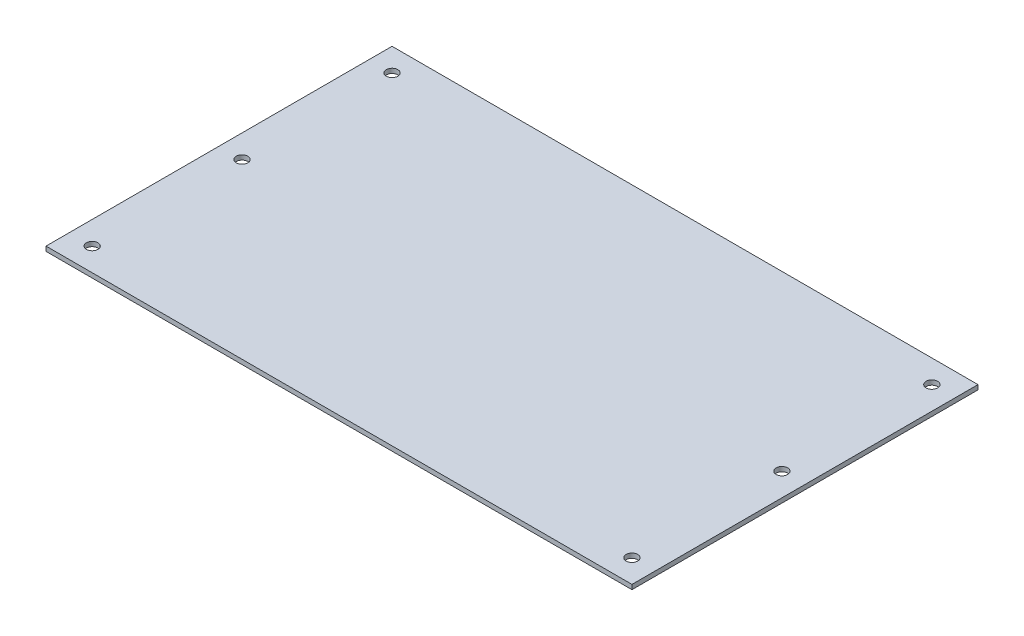
from build123d import *

# Parameters (mm, degrees)
SZKIC1_W                    = 254
SZKIC1_H                    = 150
SZKIC1_R                    = 2.5
DODANIE_WYCI_GNI_CIE1_DEPTH = 2


with BuildPart() as part:
    # Szkic1 → Dodanie-wyciągnięcie1 (new body)
    with BuildSketch(Plane(origin=(0, 0, 0), x_dir=(1, 0, 0), z_dir=(0, 1, 0))):
        Rectangle(SZKIC1_W, SZKIC1_H)
        with Locations((-117, -65)):
            Circle(SZKIC1_R, mode=Mode.SUBTRACT)
        with Locations((117, -65)):
            Circle(SZKIC1_R, mode=Mode.SUBTRACT)
        with Locations((-117, 0)):
            Circle(SZKIC1_R, mode=Mode.SUBTRACT)
        with Locations((-117, 65)):
            Circle(SZKIC1_R, mode=Mode.SUBTRACT)
        with Locations((117, 0)):
            Circle(SZKIC1_R, mode=Mode.SUBTRACT)
        with Locations((117, 65)):
            Circle(SZKIC1_R, mode=Mode.SUBTRACT)
    extrude(amount=DODANIE_WYCI_GNI_CIE1_DEPTH)


solid = part.part
